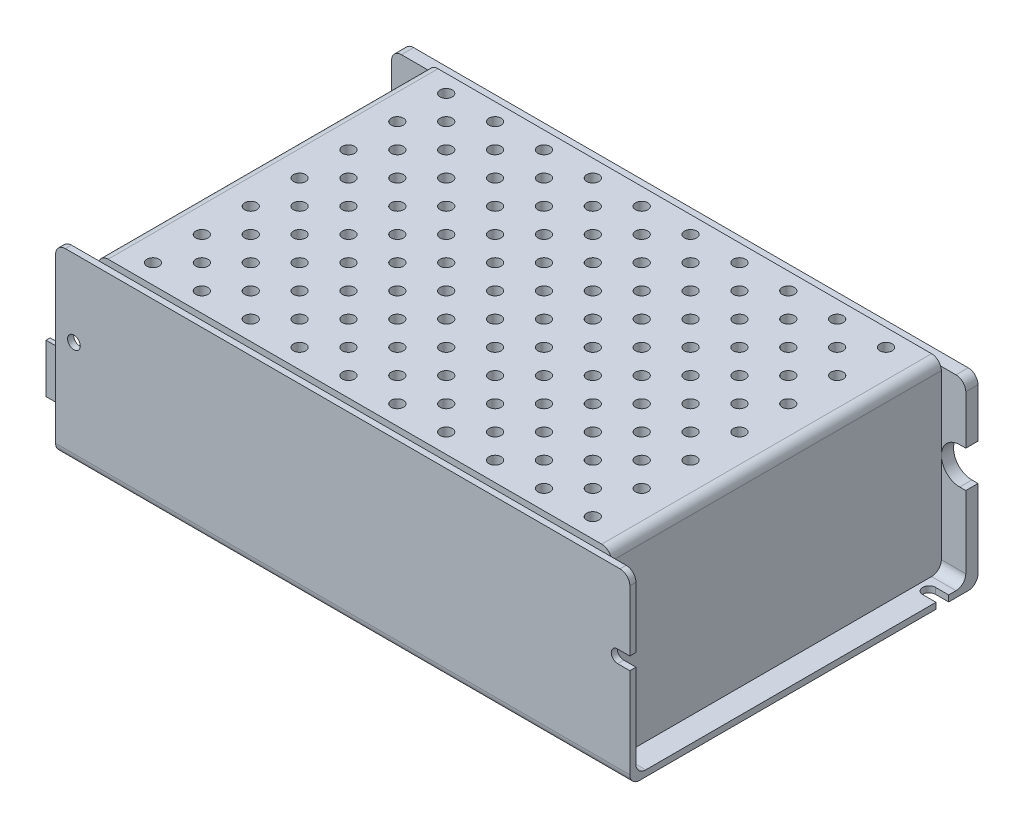
from build123d import *

# Parameters (mm, degrees)
SKETCH1_W           = 133.35
SKETCH1_H           = 85.725
BOSS_EXTRUDE1_DEPTH = 47.625
BOSS_EXTRUDE2_DEPTH = 149.225
SKETCH3_R           = 1.651
CUT_EXTRUDE1_DEPTH  = 101.965499213
SKETCH4_W           = 50.8
SKETCH4_H           = 12.7
BOSS_EXTRUDE3_DEPTH = 19.05
SKETCH5_W           = 9.525
SKETCH5_H           = 8.89
CUT_EXTRUDE2_DEPTH  = 103.353747031
CUT_EXTRUDE3_REACH  = 135.435
CUT_EXTRUDE4_REACH  = 135.435
SKETCH7_R           = 1.651
FILLET1_R           = 2.54
FILLET2_R           = 2.54
SKETCH8_R           = 1.5875
CUT_EXTRUDE5_DEPTH  = 5.08


with BuildPart() as part:
    # Sketch1 → Boss-Extrude1 (new body)
    with BuildSketch(Plane(origin=(0, 0, 0), x_dir=(1, 0, 0), z_dir=(0, 1, 0))):
        Rectangle(SKETCH1_W, SKETCH1_H)
    extrude(amount=BOSS_EXTRUDE1_DEPTH)

    # Sketch2 → Boss-Extrude2 (add)
    with BuildSketch(Plane(origin=(73.025, 0, 0), x_dir=(0, 0, -1), z_dir=(1, 0, 0))):
        Polygon((-42.8625, 46.0375), (-44.45, 46.0375), (-44.45, -1.5875), (46.0375, -1.5875), (46.0375, 46.0375), (42.8625, 46.0375), (42.8625, 0), (-42.8625, 0), align=None)
    extrude(amount=-BOSS_EXTRUDE2_DEPTH)

    # Sketch3 → Cut-Extrude1 (cut, through all)
    with BuildSketch(Plane(origin=(0, 0, 0), x_dir=(1, 0, 0), z_dir=(0, 1, 0))):
        with Locations(Location((-71.4375, -38.1, 0), (0, 0, 270))):
            Circle(SKETCH3_R)
        with BuildLine():
            Line((73.025, 38.4175), (69.581084052, 38.4175))
            ThreePointArc((69.581084052, 38.4175), (67.930084052, 36.7665), (69.581084052, 35.1155))
            Line((69.581084052, 35.1155), (73.025, 35.1155))
            Line((73.025, 35.1155), (73.025, 38.4175))
        make_face()
        Polygon((-76.2, 14.968456528), (-71.4375, 10.205956528), (-71.4375, -34.244043472), (-76.2, -39.006543472), align=None)
    extrude(amount=-CUT_EXTRUDE1_DEPTH, mode=Mode.SUBTRACT)

    # Sketch4 → Boss-Extrude3 (add)
    with BuildSketch(Plane.ZY.offset(66.675)):
        with Locations((12.019043472, 9.525)):
            Rectangle(SKETCH4_W, SKETCH4_H)
    extrude(amount=BOSS_EXTRUDE3_DEPTH)

    # Sketch5 → Cut-Extrude2 (cut, through all)
    with BuildSketch(Plane(origin=(0, 15.875, 0), x_dir=(1, 0, 0), z_dir=(0, 1, 0))):
        with Locations((-80.9625, 7.877623195)):
            Rectangle(SKETCH5_W, SKETCH5_H)
        with Locations((-80.9625, -2.070710139)):
            Rectangle(SKETCH5_W, SKETCH5_H)
        with Locations((-80.9625, -12.019043472)):
            Rectangle(SKETCH5_W, SKETCH5_H)
        with Locations((-80.9625, -21.967376805)):
            Rectangle(SKETCH5_W, SKETCH5_H)
        with Locations((-80.9625, -31.915710139)):
            Rectangle(SKETCH5_W, SKETCH5_H)
    extrude(amount=-CUT_EXTRUDE2_DEPTH, mode=Mode.SUBTRACT)

    # Sketch6 → Cut-Extrude3 (cut, up to next)
    with BuildSketch(Plane(origin=(0, 0, -46.0375), x_dir=(-1, 0, 0), z_dir=(0, 0, -1)), mode=Mode.PRIVATE) as cut_extrude3_sk1:
        with BuildLine():
            Line((-73.025, 30.7975), (-71.4375, 30.7975))
            ThreePointArc((-71.4375, 30.7975), (-66.675, 26.035), (-71.4375, 21.2725))
            Line((-71.4375, 21.2725), (-73.025, 21.2725))
            Line((-73.025, 21.2725), (-73.025, 30.7975))
        make_face()
    cut_extrude3_tool1 = extrude(cut_extrude3_sk1.sketch, amount=-CUT_EXTRUDE3_REACH, mode=Mode.PRIVATE) & part.part
    # Sketch6 → Cut-Extrude3 (cut, up to next)
    with BuildSketch(Plane(origin=(0, 0, -46.0375), x_dir=(-1, 0, 0), z_dir=(0, 0, -1)), mode=Mode.PRIVATE) as cut_extrude3_sk2:
        with BuildLine():
            Line((74.6125, 30.7975), (76.2, 30.7975))
            Line((76.2, 30.7975), (76.2, 21.2725))
            Line((76.2, 21.2725), (74.6125, 21.2725))
            ThreePointArc((74.6125, 21.2725), (69.85, 26.035), (74.6125, 30.7975))
        make_face()
    cut_extrude3_tool2 = extrude(cut_extrude3_sk2.sketch, amount=-CUT_EXTRUDE3_REACH, mode=Mode.PRIVATE) & part.part
    add(cut_extrude3_tool1.solids().sort_by_distance((70.254985, 26.035, -46.0375))[0], mode=Mode.SUBTRACT)
    add(cut_extrude3_tool2.solids().sort_by_distance((-73.429985, 26.035, -46.0375))[0], mode=Mode.SUBTRACT)

    # Sketch7 → Cut-Extrude4 (cut, up to next)
    with BuildSketch(Plane.XY.offset(44.45), mode=Mode.PRIVATE) as cut_extrude4_sk1:
        with Locations((-71.4375, 26.035)):
            Circle(SKETCH7_R)
    cut_extrude4_tool1 = extrude(cut_extrude4_sk1.sketch, amount=-CUT_EXTRUDE4_REACH, mode=Mode.PRIVATE) & part.part
    # Sketch7 → Cut-Extrude4 (cut, up to next)
    with BuildSketch(Plane.XY.offset(44.45), mode=Mode.PRIVATE) as cut_extrude4_sk2:
        with BuildLine():
            Line((73.025, 27.686), (69.85, 27.686))
            ThreePointArc((69.85, 27.686), (68.199, 26.035), (69.85, 24.384))
            Line((69.85, 24.384), (73.025, 24.384))
            Line((73.025, 24.384), (73.025, 27.686))
        make_face()
    cut_extrude4_tool2 = extrude(cut_extrude4_sk2.sketch, amount=-CUT_EXTRUDE4_REACH, mode=Mode.PRIVATE) & part.part
    add(cut_extrude4_tool1.solids().sort_by_distance((-71.4375, 26.035, 44.45))[0], mode=Mode.SUBTRACT)
    add(cut_extrude4_tool2.solids().sort_by_distance((70.773971, 26.035, 44.45))[0], mode=Mode.SUBTRACT)

    # Fillet1
    # the kernel refuses this fillet: 2.54 mm, written as the material it takes off along each edge
    with BuildSketch(Plane(origin=(66.675, 47.625, -42.8625), x_dir=(0, -1, 0), z_dir=(0, 0, 1))) as fillet1_piece_1:
        with BuildLine():
            CenterArc((FILLET1_R, -FILLET1_R), FILLET1_R, 90, 90)
            Line((0, -FILLET1_R), (0, 0))
            Line((0, 0), (FILLET1_R, 0))
        make_face()
    extrude(amount=85.725, mode=Mode.SUBTRACT)
    with BuildSketch(Plane(origin=(-76.2, 46.0375, -52.3875), x_dir=(1, 0, 0), z_dir=(0, 0, 1))) as fillet1_piece_2:
        with BuildLine():
            CenterArc((FILLET1_R, -FILLET1_R), FILLET1_R, 90, 90)
            Line((0, -FILLET1_R), (0, 0))
            Line((0, 0), (FILLET1_R, 0))
        make_face()
    extrude(amount=15.875, mode=Mode.SUBTRACT)
    with BuildSketch(Plane(origin=(-76.2, 46.0375, 36.5125), x_dir=(1, 0, 0), z_dir=(0, 0, 1)), Plane(origin=(73.025, 46.0375, 36.5125), x_dir=(0, -1, 0), z_dir=(0, 0, 1))) as fillet1_piece_3:
        with BuildLine():
            CenterArc((FILLET1_R, -FILLET1_R), FILLET1_R, 90, 90)
            Line((0, -FILLET1_R), (0, 0))
            Line((0, 0), (FILLET1_R, 0))
        make_face()
    extrude(amount=14.2875, mode=Mode.SUBTRACT)
    with BuildSketch(Plane(origin=(73.025, 46.0375, -52.3875), x_dir=(-1, 0, 0), z_dir=(0, 0, 1))) as fillet1_piece_4:
        with BuildLine():
            CenterArc((FILLET1_R, FILLET1_R), FILLET1_R, 180, 90)
            Line((0, FILLET1_R), (0, 0))
            Line((0, 0), (FILLET1_R, 0))
        make_face()
    extrude(amount=15.875, mode=Mode.SUBTRACT)
    with BuildSketch(Plane(origin=(-66.675, 47.625, 42.8625), x_dir=(1, 0, 0), z_dir=(0, 0, -1))) as fillet1_piece_5:
        with BuildLine():
            CenterArc((FILLET1_R, FILLET1_R), FILLET1_R, 180, 90)
            Line((0, FILLET1_R), (0, 0))
            Line((0, 0), (FILLET1_R, 0))
        make_face()
    extrude(amount=85.725, mode=Mode.SUBTRACT)

    # Fillet2
    fillet2_edges = [part.edges().sort_by_distance(p)[0] for p in [
        (-71.4375, 0, 42.8625),
        (69.85, 0, 42.8625),
        (-71.4375, 0, -42.8625),
        (69.85, 0, -42.8625),
        (-1.5875, -1.5875, -46.0375),
        (-1.5875, -1.5875, 44.45),
    ]]
    fillet(fillet2_edges, radius=FILLET2_R)

    # Sketch8 → Cut-Extrude5 (cut)
    with BuildSketch(Plane(origin=(0, 47.625, 0), x_dir=(1, 0, 0), z_dir=(0, 1, 0))):
        with Locations(Location((-57.511348285, 38.37033034, 0), (0, 0, 270))):
            Circle(SKETCH8_R)
        with Locations(Location((-44.811348285, 38.37033034, 0), (0, 0, 270))):
            Circle(SKETCH8_R)
        with Locations(Location((-32.111348285, 38.37033034, 0), (0, 0, 270))):
            Circle(SKETCH8_R)
        with Locations(Location((-19.411348285, 38.37033034, 0), (0, 0, 270))):
            Circle(SKETCH8_R)
        with Locations(Location((-6.711348285, 38.37033034, 0), (0, 0, 270))):
            Circle(SKETCH8_R)
        with Locations(Location((5.988651715, 38.37033034, 0), (0, 0, 270))):
            Circle(SKETCH8_R)
        with Locations(Location((18.688651715, 38.37033034, 0), (0, 0, 270))):
            Circle(SKETCH8_R)
        with Locations(Location((31.388651715, 38.37033034, 0), (0, 0, 270))):
            Circle(SKETCH8_R)
        with Locations(Location((44.088651715, 38.37033034, 0), (0, 0, 270))):
            Circle(SKETCH8_R)
        with Locations(Location((56.788651715, 38.37033034, 0), (0, 0, 270))):
            Circle(SKETCH8_R)
        with Locations(Location((-44.811348285, 25.67033034, 0), (0, 0, 270))):
            Circle(SKETCH8_R)
        with Locations(Location((-32.111348285, 25.67033034, 0), (0, 0, 270))):
            Circle(SKETCH8_R)
        with Locations(Location((-19.411348285, 25.67033034, 0), (0, 0, 270))):
            Circle(SKETCH8_R)
        with Locations(Location((-6.711348285, 25.67033034, 0), (0, 0, 270))):
            Circle(SKETCH8_R)
        with Locations(Location((5.988651715, 25.67033034, 0), (0, 0, 270))):
            Circle(SKETCH8_R)
        with Locations(Location((18.688651715, 25.67033034, 0), (0, 0, 270))):
            Circle(SKETCH8_R)
        with Locations(Location((31.388651715, 25.67033034, 0), (0, 0, 270))):
            Circle(SKETCH8_R)
        with Locations(Location((44.088651715, 25.67033034, 0), (0, 0, 270))):
            Circle(SKETCH8_R)
        with Locations(Location((56.788651715, 25.67033034, 0), (0, 0, 270))):
            Circle(SKETCH8_R)
        with Locations(Location((-44.811348285, 12.97033034, 0), (0, 0, 270))):
            Circle(SKETCH8_R)
        with Locations(Location((-32.111348285, 12.97033034, 0), (0, 0, 270))):
            Circle(SKETCH8_R)
        with Locations(Location((-19.411348285, 12.97033034, 0), (0, 0, 270))):
            Circle(SKETCH8_R)
        with Locations(Location((-6.711348285, 12.97033034, 0), (0, 0, 270))):
            Circle(SKETCH8_R)
        with Locations(Location((5.988651715, 12.97033034, 0), (0, 0, 270))):
            Circle(SKETCH8_R)
        with Locations(Location((18.688651715, 12.97033034, 0), (0, 0, 270))):
            Circle(SKETCH8_R)
        with Locations(Location((31.388651715, 12.97033034, 0), (0, 0, 270))):
            Circle(SKETCH8_R)
        with Locations(Location((44.088651715, 12.97033034, 0), (0, 0, 270))):
            Circle(SKETCH8_R)
        with Locations(Location((56.788651715, 12.97033034, 0), (0, 0, 270))):
            Circle(SKETCH8_R)
        with Locations(Location((-44.811348285, 0.27033034, 0), (0, 0, 270))):
            Circle(SKETCH8_R)
        with Locations(Location((-32.111348285, 0.27033034, 0), (0, 0, 270))):
            Circle(SKETCH8_R)
        with Locations(Location((-19.411348285, 0.27033034, 0), (0, 0, 270))):
            Circle(SKETCH8_R)
        with Locations(Location((-6.711348285, 0.27033034, 0), (0, 0, 270))):
            Circle(SKETCH8_R)
        with Locations(Location((5.988651715, 0.27033034, 0), (0, 0, 270))):
            Circle(SKETCH8_R)
        with Locations(Location((18.688651715, 0.27033034, 0), (0, 0, 270))):
            Circle(SKETCH8_R)
        with Locations(Location((31.388651715, 0.27033034, 0), (0, 0, 270))):
            Circle(SKETCH8_R)
        with Locations(Location((44.088651715, 0.27033034, 0), (0, 0, 270))):
            Circle(SKETCH8_R)
        with Locations(Location((56.788651715, 0.27033034, 0), (0, 0, 270))):
            Circle(SKETCH8_R)
        with Locations(Location((-44.811348285, -12.42966966, 0), (0, 0, 270))):
            Circle(SKETCH8_R)
        with Locations(Location((-32.111348285, -12.42966966, 0), (0, 0, 270))):
            Circle(SKETCH8_R)
        with Locations(Location((-19.411348285, -12.42966966, 0), (0, 0, 270))):
            Circle(SKETCH8_R)
        with Locations(Location((-6.711348285, -12.42966966, 0), (0, 0, 270))):
            Circle(SKETCH8_R)
        with Locations(Location((5.988651715, -12.42966966, 0), (0, 0, 270))):
            Circle(SKETCH8_R)
        with Locations(Location((18.688651715, -12.42966966, 0), (0, 0, 270))):
            Circle(SKETCH8_R)
        with Locations(Location((31.388651715, -12.42966966, 0), (0, 0, 270))):
            Circle(SKETCH8_R)
        with Locations(Location((44.088651715, -12.42966966, 0), (0, 0, 270))):
            Circle(SKETCH8_R)
        with Locations(Location((56.788651715, -12.42966966, 0), (0, 0, 270))):
            Circle(SKETCH8_R)
        with Locations(Location((-44.811348285, -25.12966966, 0), (0, 0, 270))):
            Circle(SKETCH8_R)
        with Locations(Location((-32.111348285, -25.12966966, 0), (0, 0, 270))):
            Circle(SKETCH8_R)
        with Locations(Location((-19.411348285, -25.12966966, 0), (0, 0, 270))):
            Circle(SKETCH8_R)
        with Locations(Location((-6.711348285, -25.12966966, 0), (0, 0, 270))):
            Circle(SKETCH8_R)
        with Locations(Location((5.988651715, -25.12966966, 0), (0, 0, 270))):
            Circle(SKETCH8_R)
        with Locations(Location((18.688651715, -25.12966966, 0), (0, 0, 270))):
            Circle(SKETCH8_R)
        with Locations(Location((31.388651715, -25.12966966, 0), (0, 0, 270))):
            Circle(SKETCH8_R)
        with Locations(Location((44.088651715, -25.12966966, 0), (0, 0, 270))):
            Circle(SKETCH8_R)
        with Locations(Location((56.788651715, -25.12966966, 0), (0, 0, 270))):
            Circle(SKETCH8_R)
        with Locations(Location((-44.811348285, -37.82966966, 0), (0, 0, 270))):
            Circle(SKETCH8_R)
        with Locations(Location((-32.111348285, -37.82966966, 0), (0, 0, 270))):
            Circle(SKETCH8_R)
        with Locations(Location((-19.411348285, -37.82966966, 0), (0, 0, 270))):
            Circle(SKETCH8_R)
        with Locations(Location((-6.711348285, -37.82966966, 0), (0, 0, 270))):
            Circle(SKETCH8_R)
        with Locations(Location((5.988651715, -37.82966966, 0), (0, 0, 270))):
            Circle(SKETCH8_R)
        with Locations(Location((18.688651715, -37.82966966, 0), (0, 0, 270))):
            Circle(SKETCH8_R)
        with Locations(Location((31.388651715, -37.82966966, 0), (0, 0, 270))):
            Circle(SKETCH8_R)
        with Locations(Location((44.088651715, -37.82966966, 0), (0, 0, 270))):
            Circle(SKETCH8_R)
        with Locations(Location((56.788651715, -37.82966966, 0), (0, 0, 270))):
            Circle(SKETCH8_R)
        with Locations(Location((-57.511348285, 25.67033034, 0), (0, 0, 270))):
            Circle(SKETCH8_R)
        with Locations(Location((-57.511348285, 12.97033034, 0), (0, 0, 270))):
            Circle(SKETCH8_R)
        with Locations(Location((-57.511348285, 0.27033034, 0), (0, 0, 270))):
            Circle(SKETCH8_R)
        with Locations(Location((-57.511348285, -12.42966966, 0), (0, 0, 270))):
            Circle(SKETCH8_R)
        with Locations(Location((-57.511348285, -25.12966966, 0), (0, 0, 270))):
            Circle(SKETCH8_R)
        with Locations(Location((-57.511348285, -37.82966966, 0), (0, 0, 270))):
            Circle(SKETCH8_R)
        with Locations(Location((-51.161348285, 32.02033034, 0), (0, 0, 270))):
            Circle(SKETCH8_R)
        with Locations(Location((-38.461348285, 32.02033034, 0), (0, 0, 270))):
            Circle(SKETCH8_R)
        with Locations(Location((-25.761348285, 32.02033034, 0), (0, 0, 270))):
            Circle(SKETCH8_R)
        with Locations(Location((-13.061348285, 32.02033034, 0), (0, 0, 270))):
            Circle(SKETCH8_R)
        with Locations(Location((-0.361348285, 32.02033034, 0), (0, 0, 270))):
            Circle(SKETCH8_R)
        with Locations(Location((12.338651715, 32.02033034, 0), (0, 0, 270))):
            Circle(SKETCH8_R)
        with Locations(Location((25.038651715, 32.02033034, 0), (0, 0, 270))):
            Circle(SKETCH8_R)
        with Locations(Location((37.738651715, 32.02033034, 0), (0, 0, 270))):
            Circle(SKETCH8_R)
        with Locations(Location((50.438651715, 32.02033034, 0), (0, 0, 270))):
            Circle(SKETCH8_R)
        with Locations(Location((-38.461348285, 19.32033034, 0), (0, 0, 270))):
            Circle(SKETCH8_R)
        with Locations(Location((-25.761348285, 19.32033034, 0), (0, 0, 270))):
            Circle(SKETCH8_R)
        with Locations(Location((-13.061348285, 19.32033034, 0), (0, 0, 270))):
            Circle(SKETCH8_R)
        with Locations(Location((-0.361348285, 19.32033034, 0), (0, 0, 270))):
            Circle(SKETCH8_R)
        with Locations(Location((12.338651715, 19.32033034, 0), (0, 0, 270))):
            Circle(SKETCH8_R)
        with Locations(Location((25.038651715, 19.32033034, 0), (0, 0, 270))):
            Circle(SKETCH8_R)
        with Locations(Location((37.738651715, 19.32033034, 0), (0, 0, 270))):
            Circle(SKETCH8_R)
        with Locations(Location((50.438651715, 19.32033034, 0), (0, 0, 270))):
            Circle(SKETCH8_R)
        with Locations(Location((-38.461348285, 6.62033034, 0), (0, 0, 270))):
            Circle(SKETCH8_R)
        with Locations(Location((-25.761348285, 6.62033034, 0), (0, 0, 270))):
            Circle(SKETCH8_R)
        with Locations(Location((-13.061348285, 6.62033034, 0), (0, 0, 270))):
            Circle(SKETCH8_R)
        with Locations(Location((-0.361348285, 6.62033034, 0), (0, 0, 270))):
            Circle(SKETCH8_R)
        with Locations(Location((12.338651715, 6.62033034, 0), (0, 0, 270))):
            Circle(SKETCH8_R)
        with Locations(Location((25.038651715, 6.62033034, 0), (0, 0, 270))):
            Circle(SKETCH8_R)
        with Locations(Location((37.738651715, 6.62033034, 0), (0, 0, 270))):
            Circle(SKETCH8_R)
        with Locations(Location((50.438651715, 6.62033034, 0), (0, 0, 270))):
            Circle(SKETCH8_R)
        with Locations(Location((-38.461348285, -6.07966966, 0), (0, 0, 270))):
            Circle(SKETCH8_R)
        with Locations(Location((-25.761348285, -6.07966966, 0), (0, 0, 270))):
            Circle(SKETCH8_R)
        with Locations(Location((-13.061348285, -6.07966966, 0), (0, 0, 270))):
            Circle(SKETCH8_R)
        with Locations(Location((-0.361348285, -6.07966966, 0), (0, 0, 270))):
            Circle(SKETCH8_R)
        with Locations(Location((12.338651715, -6.07966966, 0), (0, 0, 270))):
            Circle(SKETCH8_R)
        with Locations(Location((25.038651715, -6.07966966, 0), (0, 0, 270))):
            Circle(SKETCH8_R)
        with Locations(Location((37.738651715, -6.07966966, 0), (0, 0, 270))):
            Circle(SKETCH8_R)
        with Locations(Location((50.438651715, -6.07966966, 0), (0, 0, 270))):
            Circle(SKETCH8_R)
        with Locations(Location((-38.461348285, -18.77966966, 0), (0, 0, 270))):
            Circle(SKETCH8_R)
        with Locations(Location((-25.761348285, -18.77966966, 0), (0, 0, 270))):
            Circle(SKETCH8_R)
        with Locations(Location((-13.061348285, -18.77966966, 0), (0, 0, 270))):
            Circle(SKETCH8_R)
        with Locations(Location((-0.361348285, -18.77966966, 0), (0, 0, 270))):
            Circle(SKETCH8_R)
        with Locations(Location((12.338651715, -18.77966966, 0), (0, 0, 270))):
            Circle(SKETCH8_R)
        with Locations(Location((25.038651715, -18.77966966, 0), (0, 0, 270))):
            Circle(SKETCH8_R)
        with Locations(Location((37.738651715, -18.77966966, 0), (0, 0, 270))):
            Circle(SKETCH8_R)
        with Locations(Location((50.438651715, -18.77966966, 0), (0, 0, 270))):
            Circle(SKETCH8_R)
        with Locations(Location((-38.461348285, -31.47966966, 0), (0, 0, 270))):
            Circle(SKETCH8_R)
        with Locations(Location((-25.761348285, -31.47966966, 0), (0, 0, 270))):
            Circle(SKETCH8_R)
        with Locations(Location((-13.061348285, -31.47966966, 0), (0, 0, 270))):
            Circle(SKETCH8_R)
        with Locations(Location((-0.361348285, -31.47966966, 0), (0, 0, 270))):
            Circle(SKETCH8_R)
        with Locations(Location((12.338651715, -31.47966966, 0), (0, 0, 270))):
            Circle(SKETCH8_R)
        with Locations(Location((25.038651715, -31.47966966, 0), (0, 0, 270))):
            Circle(SKETCH8_R)
        with Locations(Location((37.738651715, -31.47966966, 0), (0, 0, 270))):
            Circle(SKETCH8_R)
        with Locations(Location((50.438651715, -31.47966966, 0), (0, 0, 270))):
            Circle(SKETCH8_R)
        with Locations(Location((-51.161348285, 19.32033034, 0), (0, 0, 270))):
            Circle(SKETCH8_R)
        with Locations(Location((-51.161348285, 6.62033034, 0), (0, 0, 270))):
            Circle(SKETCH8_R)
        with Locations(Location((-51.161348285, -6.07966966, 0), (0, 0, 270))):
            Circle(SKETCH8_R)
        with Locations(Location((-51.161348285, -18.77966966, 0), (0, 0, 270))):
            Circle(SKETCH8_R)
        with Locations(Location((-51.161348285, -31.47966966, 0), (0, 0, 270))):
            Circle(SKETCH8_R)
    extrude(amount=-CUT_EXTRUDE5_DEPTH, mode=Mode.SUBTRACT)


solid = part.part
